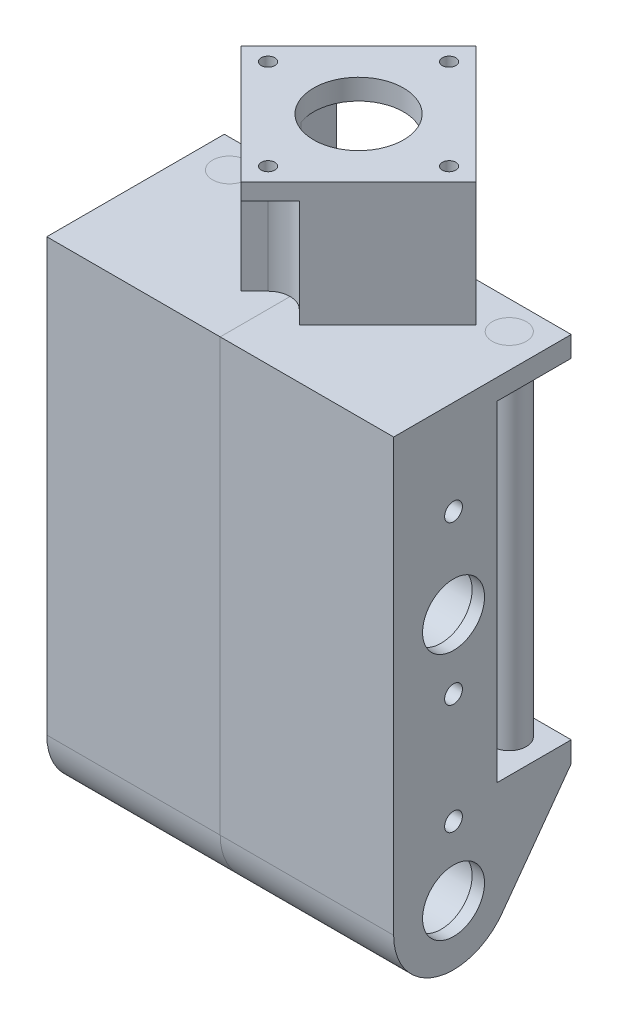
from build123d import *

# Parameters (mm, degrees)
SKETCH1_R               = 9.5
SKETCH1_R_2             = 2.15
BOSS_EXTRUDE1_DEPTH     = 42
SKETCH3_W               = 24.75
SKETCH3_H               = 18
CUT_EXTRUDE2_DEPTH      = 91.147102006
CUT_EXTRUDE3_DEPTH      = 91.147102006
CUT_EXTRUDE3_DEPTH_BACK = 15.5
SKETCH3_3_R             = 4.125
BOSS_EXTRUDE2_START     = 39
SKETCH1_3_R             = 9.5
SKETCH1_3_R_2           = 7.5
BOSS_EXTRUDE2_DEPTH     = 3
SKETCH4_R               = 1.65
BOSS_EXTRUDE3_DEPTH     = 30
CUT_EXTRUDE5_START      = -5
CUT_EXTRUDE5_DEPTH      = 5
BOSS_EXTRUDE4_START     = 25
SKETCH4_4_R             = 1.65
SKETCH4_4_R_2           = 10.89008473
BOSS_EXTRUDE4_DEPTH     = 5
CUT_EXTRUDE6_DEPTH      = 135.83659861
CUT_EXTRUDE6_DEPTH_BACK = 135.83659861
SKETCH4_5_R             = 1.65
CUT_EXTRUDE7_START      = -4
CUT_EXTRUDE7_DEPTH      = 26
SKETCH5_3_R             = 1.65
CUT_EXTRUDE8_DEPTH      = 5
SKETCH6_R               = 4.125
BOSS_EXTRUDE5_DEPTH     = 90
BOSS_EXTRUDE5_2_DEPTH   = 90


# Read off the part's stored shape, not the designer's step: Split2
with BuildPart() as part:
    # Sketch1 → Boss-Extrude1 (new body)
    with BuildSketch(Plane(origin=(0, 0, 0), x_dir=(0, 0, -1), z_dir=(1, 0, 0))):
        with BuildLine():
            Line((-14.5, 74.5), (-14.5, -30))
            ThreePointArc((-14.5, -30), (-4.488997688, -43.787635757), (11.720537897, -38.536919315))
            Line((11.720537897, -38.536919315), (28.5, -15.5))
            Line((28.5, -15.5), (28.5, -10.5))
            Line((28.5, -10.5), (10.5, -10.5))
            Line((10.5, -10.5), (10.5, 69.5))
            Line((10.5, 69.5), (28.5, 69.5))
            Line((28.5, 69.5), (28.5, 74.5))
            Line((28.5, 74.5), (-14.5, 74.5))
        make_face()
        with Locations(Location((0, 30, 0), (0, 0, 180))):
            Circle(SKETCH1_R, mode=Mode.SUBTRACT)
        with Locations(Location((0, -30, 0), (0, 0, 180))):
            Circle(SKETCH1_R, mode=Mode.SUBTRACT)
        with Locations(Location((0, 13.35, 0), (0, 0, 180))):
            Circle(SKETCH1_R_2, mode=Mode.SUBTRACT)
        with Locations(Location((0, -13.35, 0), (0, 0, 180))):
            Circle(SKETCH1_R_2, mode=Mode.SUBTRACT)
        with Locations(Location((0, 51.65, 0), (0, 0, 180))):
            Circle(SKETCH1_R_2, mode=Mode.SUBTRACT)
    extrude(amount=BOSS_EXTRUDE1_DEPTH)

    # Sketch3 → Cut-Extrude2 (cut, through all)
    with BuildSketch(Plane(origin=(0, 0, 0), x_dir=(1, 0, 0), z_dir=(0, 1, 0))):
        with Locations((12.375, 19.5)):
            Rectangle(SKETCH3_W, SKETCH3_H)
    extrude(amount=-CUT_EXTRUDE2_DEPTH, mode=Mode.SUBTRACT)

    # Sketch3<3> → Cut-Extrude3 (cut, two sides: drawn at the far end of the back side and taken through both)
    with BuildSketch(Plane(origin=(0, 0, 0), x_dir=(1, 0, 0), z_dir=(0, 1, 0)).offset(-CUT_EXTRUDE3_DEPTH_BACK)):
        with Locations(Location((33.875, 21.625, 0), (0, 0, 270))):
            Circle(SKETCH3_3_R)
    extrude(amount=CUT_EXTRUDE3_DEPTH + CUT_EXTRUDE3_DEPTH_BACK, mode=Mode.SUBTRACT)

    # Sketch1<3> → Boss-Extrude2 (add)
    # profile 1 of 2: a face of its own
    with BuildSketch(Plane(origin=(0, 0, 0), x_dir=(0, 0, -1), z_dir=(1, 0, 0)).offset(BOSS_EXTRUDE2_START)):
        with Locations(Location((0, 30, 0), (0, 0, 180))):
            Circle(SKETCH1_3_R)
        with Locations((0, 30)):
            Circle(SKETCH1_3_R_2, mode=Mode.SUBTRACT)
    # profile 2 of 2: a face of its own
    with BuildSketch(Plane(origin=(0, 0, 0), x_dir=(0, 0, -1), z_dir=(1, 0, 0)).offset(BOSS_EXTRUDE2_START)):
        with Locations(Location((0, -30, 0), (0, 0, 180))):
            Circle(SKETCH1_3_R)
        with Locations((0, -30)):
            Circle(SKETCH1_3_R_2, mode=Mode.SUBTRACT)
    extrude(amount=BOSS_EXTRUDE2_DEPTH)


with BuildPart() as body_2:
    # Mirror1: mirrored copy
    add(part.part.mirror(Plane(origin=(0, 0, 0), x_dir=(0, 0, 1), z_dir=(1, 0, 0))))


with BuildPart() as part_1:
    add(part.part)

    add(body_2.part)  # Boss-Extrude3 merges body 2
    # Sketch4 → Boss-Extrude3 (add)
    # profile 1 of 2: a face of its own
    with BuildSketch(Plane(origin=(0, 74.5, 0), x_dir=(1, 0, 0), z_dir=(0, 1, 0))):
        with BuildLine():
            Line((28.496403282, 19), (18.996403282, 28.5))
            Line((18.996403282, 28.5), (14.880337046, 28.5))
            Line((14.880337046, 28.5), (10.27441199, 15.390234954))
            ThreePointArc((10.27441199, 15.390234954), (6.296161458, 10.11448953), (0, 8.10991527))
            Line((0, 8.10991527), (0, -9.496403282))
            Line((0, -9.496403282), (28.496403282, 19))
        make_face()
        with Locations(Location((21.920310217, 19, 0), (0, 0, 270))):
            Circle(SKETCH4_R, mode=Mode.SUBTRACT)
    # profile 2 of 2: a face of its own
    with BuildSketch(Plane(origin=(0, 74.5, 0), x_dir=(1, 0, 0), z_dir=(0, 1, 0))):
        with BuildLine():
            Line((-28.496403282, 19), (0, -9.496403282))
            Line((0, -9.496403282), (0, 8.10991527))
            ThreePointArc((0, 8.10991527), (-6.296161458, 10.11448953), (-10.27441199, 15.390234954))
            Line((-10.27441199, 15.390234954), (-14.880337046, 28.5))
            Line((-14.880337046, 28.5), (-18.996403282, 28.5))
            Line((-18.996403282, 28.5), (-28.496403282, 19))
        make_face()
        with Locations(Location((-21.920310217, 19, 0), (0, 0, 270))):
            Circle(SKETCH4_R, mode=Mode.SUBTRACT)
    extrude(amount=BOSS_EXTRUDE3_DEPTH)

    # Sketch4<3> → Cut-Extrude5 (cut)
    with BuildSketch(Plane(origin=(0, 74.5, 0), x_dir=(1, 0, 0), z_dir=(0, 1, 0)).offset(CUT_EXTRUDE5_START)):
        with BuildLine():
            Line((10.27441199, 15.390234954), (14.880337046, 28.5))
            Line((14.880337046, 28.5), (-14.880337046, 28.5))
            Line((-14.880337046, 28.5), (-10.27441199, 15.390234954))
            ThreePointArc((-10.27441199, 15.390234954), (0, 8.10991527), (10.27441199, 15.390234954))
        make_face()
    extrude(amount=CUT_EXTRUDE5_DEPTH, mode=Mode.SUBTRACT)

    # Sketch4<4> → Boss-Extrude4 (add)
    with BuildSketch(Plane(origin=(0, 74.5, 0), x_dir=(1, 0, 0), z_dir=(0, 1, 0)).offset(BOSS_EXTRUDE4_START)):
        Polygon((0, -9.496403282), (28.496403282, 19), (0, 47.496403282), (-28.496403282, 19), align=None)
        with Locations(Location((21.920310217, 19, 0), (0, 0, 270))):
            Circle(SKETCH4_4_R, mode=Mode.SUBTRACT)
        with Locations(Location((-21.920310217, 19, 0), (0, 0, 270))):
            Circle(SKETCH4_4_R, mode=Mode.SUBTRACT)
        with Locations(Location((0, 40.920310217, 0), (0, 0, 270))):
            Circle(SKETCH4_4_R, mode=Mode.SUBTRACT)
        with Locations(Location((0, 19, 0), (0, 0, 340.641817362))):
            Circle(SKETCH4_4_R_2, mode=Mode.SUBTRACT)
    extrude(amount=BOSS_EXTRUDE4_DEPTH)

    # Sketch4<5> → Cut-Extrude6 (cut, two sides: drawn at the far end of the back side and taken through both)
    with BuildSketch(Plane(origin=(0, 74.5, 0), x_dir=(1, 0, 0), z_dir=(0, 1, 0)).offset(-CUT_EXTRUDE6_DEPTH_BACK)):
        with Locations(Location((21.920310217, 19, 0), (0, 0, 90))):
            Circle(SKETCH4_5_R)
        with Locations(Location((-21.920310217, 19, 0), (0, 0, 90))):
            Circle(SKETCH4_5_R)
        with Locations(Location((0, 40.920310217, 0), (0, 0, 270))):
            Circle(SKETCH4_5_R)
    extrude(amount=CUT_EXTRUDE6_DEPTH + CUT_EXTRUDE6_DEPTH_BACK, mode=Mode.SUBTRACT)

    # Sketch5 → Cut-Extrude7 (cut)
    with BuildSketch(Plane(origin=(0, 104.5, 0), x_dir=(1, 0, 0), z_dir=(0, 1, 0)).offset(CUT_EXTRUDE7_START)):
        with BuildLine():
            Line((3.783021279, 0.862711063), (7.071067812, -2.42533547))
            Line((7.071067812, -2.42533547), (0, -9.496403282))
            Line((0, -9.496403282), (-7.071067812, -2.42533547))
            Line((-7.071067812, -2.42533547), (-3.783021279, 0.862711063))
            ThreePointArc((-3.783021279, 0.862711063), (0, 2.429689783), (3.783021279, 0.862711063))
        make_face()
    extrude(amount=-CUT_EXTRUDE7_DEPTH, mode=Mode.SUBTRACT)

    # Sketch5<3> → Cut-Extrude8 (cut)
    with BuildSketch(Plane(origin=(0, 104.5, 0), x_dir=(1, 0, 0), z_dir=(0, 1, 0))):
        with Locations(Location((0, -2.920310217, 0), (0, 0, 270))):
            Circle(SKETCH5_3_R)
    extrude(amount=-CUT_EXTRUDE8_DEPTH, mode=Mode.SUBTRACT)


with BuildPart() as body_2_2:
    # Sketch6 → Boss-Extrude5 (new body)
    with BuildSketch(Plane(origin=(0, -15.5, 0), x_dir=(1, 0, 0), z_dir=(0, 1, 0))):
        with Locations(Location((33.875, 21.625, 0), (0, 0, 270))):
            Circle(SKETCH6_R)
    extrude(amount=BOSS_EXTRUDE5_DEPTH)


with BuildPart() as body_3:
    # Sketch6 → Boss-Extrude5 2 (new body)
    with BuildSketch(Plane(origin=(0, -15.5, 0), x_dir=(1, 0, 0), z_dir=(0, 1, 0))):
        with Locations(Location((-33.875, 21.625, 0), (0, 0, 270))):
            Circle(SKETCH6_R)
    extrude(amount=BOSS_EXTRUDE5_2_DEPTH)


with BuildPart() as body_4:
    # Split3: the piece on the far side of the plane
    add(part_1.part)
    split(bisect_by=Plane.ZX.offset(74.5), keep=Keep.BOTTOM)


with BuildPart() as part_2:
    add(part_1.part)

    # Split3
    split(bisect_by=Plane.ZX.offset(74.5), keep=Keep.TOP)


with BuildPart() as body_5:
    # Split2: the piece on the far side of the plane
    add(body_4.part)
    split(bisect_by=Plane.YZ, keep=Keep.BOTTOM)


with BuildPart() as body_4_1:
    add(body_4.part)

    # Split2
    split(bisect_by=Plane.YZ, keep=Keep.TOP)


solid = Compound([body_2_2.part, body_3.part, part_2.part, body_5.part, body_4_1.part])
